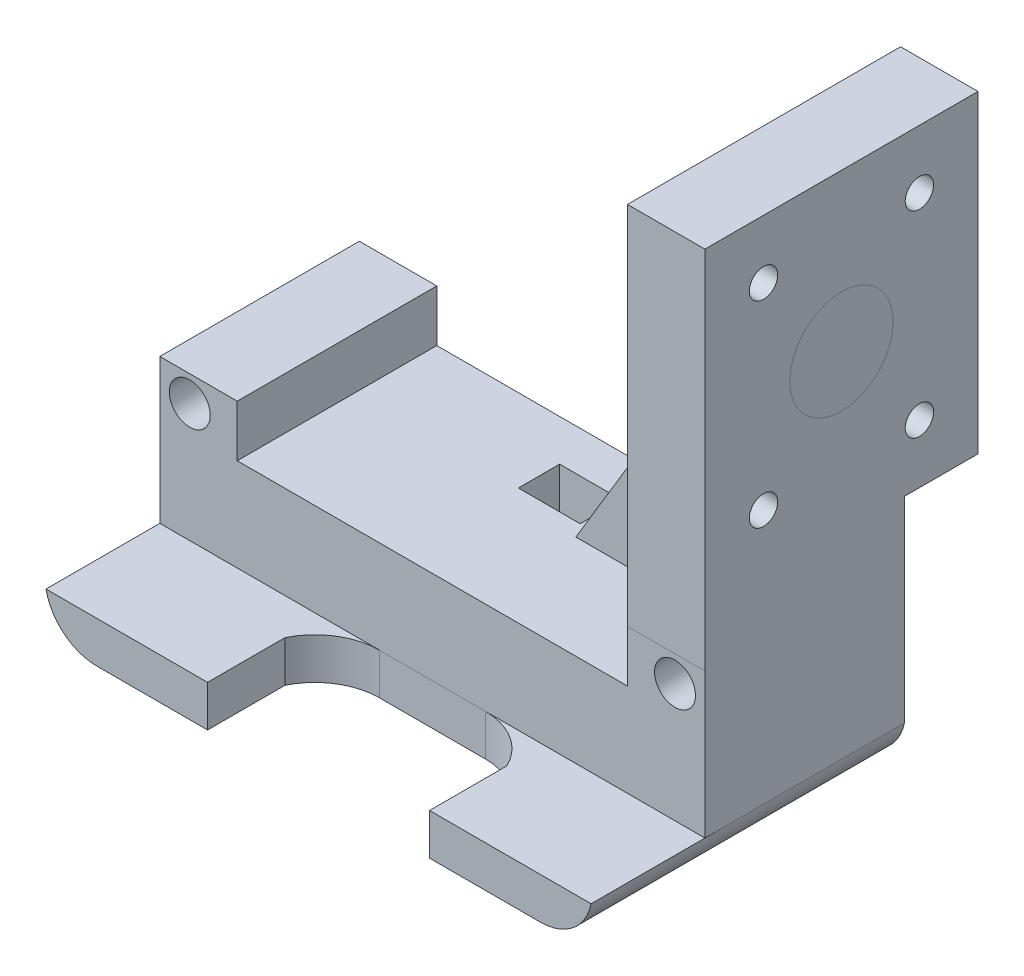
from build123d import *

# Parameters (mm, degrees)
SKETCH2_W                      = 90
SKETCH2_H                      = 30
BOSS_EXTRUDE1_DEPTH            = 184.15
SHELL1_T                       = 8
FILLET1_R                      = 10
CUT_EXTRUDE1_DEPTH             = 15
BOSS_EXTRUDE3_DEPTH            = 12.7
SKETCH19_W                     = 50.7
SKETCH19_H                     = 190.15
CUT_EXTRUDE3_DEPTH             = 160
CUT_EXTRUDE4_DEPTH             = 62.424750712
CUT_EXTRUDE5_DEPTH             = 83.99843372
CUT_EXTRUDE5_DEPTH_BACK        = 83.99843372
SKETCH21_W                     = 50.7
SKETCH21_H                     = 2
SKETCH22_W                     = 105.595917942
SKETCH22_H                     = 28.653888285
BOSS_EXTRUDE4_DEPTH            = 18
SKETCH25_W                     = 12
SKETCH25_H                     = 6
CUT_EXTRUDE7_DEPTH             = 69.833963067
BOSS_EXTRUDE6_DEPTH            = 10
SKETCH27_W                     = 12
SKETCH27_H                     = 8
BOSS_EXTRUDE7_DEPTH            = 26
SKETCH31_W                     = 15
SKETCH31_H                     = 38.653888285
BOSS_EXTRUDE8_DEPTH            = 10
F_5_16_0_3125_DIAMETER_HOLE2_D = 7.9375
SKETCH35_W                     = 52.9
SKETCH35_H                     = 70.8
BOSS_EXTRUDE9_DEPTH            = 15
F_5_5_5_5_DIAMETER_HOLE1_D     = 5.5
BOSS_EXTRUDE10_DEPTH           = 38.653888285
CUT_EXTRUDE8_DEPTH             = 20
CUT_EXTRUDE10_DEPTH            = 2
SKETCH43_W                     = 14.246111715
SKETCH43_H                     = 10
CUT_EXTRUDE11_DEPTH            = 157.542244125


with BuildPart() as part:
    # Sketch2 → Boss-Extrude1 (new body)
    with BuildSketch(Plane(origin=(0, 0, 0), x_dir=(1, 0, 0), z_dir=(0, 1, 0))):
        Rectangle(SKETCH2_W, SKETCH2_H)
    extrude(amount=BOSS_EXTRUDE1_DEPTH)

    # Shell1
    shell1_openings = [part.faces().sort_by_distance(p)[0] for p in [
        (0, 92.075, 15),
    ]]
    offset(amount=SHELL1_T, openings=shell1_openings, kind=Kind.INTERSECTION)

    # Fillet1
    # the kernel refuses this fillet: 10 mm, written as the material it adds along each edge
    with BuildSketch(Plane(origin=(-45, 0, -15), x_dir=(0, 1, 0), z_dir=(0, 0, 1)), Plane(origin=(45, 0, 15), x_dir=(0, 1, 0), z_dir=(0, 0, -1))) as fillet1_piece_1:
        with BuildLine():
            CenterArc((FILLET1_R, -FILLET1_R), FILLET1_R, 90, 90)
            Line((0, -FILLET1_R), (0, 0))
            Line((0, 0), (FILLET1_R, 0))
        make_face()
    extrude(amount=30)
    with BuildSketch(Plane(origin=(-45, 184.15, -15), x_dir=(0, -1, 0), z_dir=(0, 0, 1)), Plane(origin=(45, 184.15, 15), x_dir=(0, -1, 0), z_dir=(0, 0, -1))) as fillet1_piece_2:
        with BuildLine():
            CenterArc((FILLET1_R, FILLET1_R), FILLET1_R, 180, 90)
            Line((0, FILLET1_R), (0, 0))
            Line((0, 0), (FILLET1_R, 0))
        make_face()
    extrude(amount=30)
    # the kernel refuses this fillet: 10 mm, written as the material it takes off along each edge
    with BuildSketch(Plane(origin=(53, 192.15, 40), x_dir=(0, -1, 0), z_dir=(0, 0, -1)), Plane(origin=(-53, 192.15, -48), x_dir=(0, -1, 0), z_dir=(0, 0, 1)), Plane(origin=(-53, -8, -48), x_dir=(1, 0, 0), z_dir=(0, 0, 1))) as fillet1_2_piece_1:
        with BuildLine():
            CenterArc((FILLET1_R, FILLET1_R), FILLET1_R, 180, 90)
            Line((0, FILLET1_R), (0, 0))
            Line((0, 0), (FILLET1_R, 0))
        make_face()
    extrude(amount=88, mode=Mode.SUBTRACT)
    with BuildSketch(Plane(origin=(53, -8, 40), x_dir=(0, 1, 0), z_dir=(0, 0, -1))) as fillet1_2_piece_2:
        with BuildLine():
            CenterArc((FILLET1_R, -FILLET1_R), FILLET1_R, 90, 90)
            Line((0, -FILLET1_R), (0, 0))
            Line((0, 0), (FILLET1_R, 0))
        make_face()
    extrude(amount=88, mode=Mode.SUBTRACT)

    # Sketch3 → Cut-Extrude1 (cut)
    with BuildSketch(Plane.XZ.offset(8)):
        with BuildLine():
            Line((-21.5, 15), (21.5, 15))
            Line((21.5, 15), (21.5, 0))
            ThreePointArc((21.5, 0), (16.888679541, -5.139118926), (10.252551286, -7.046111715))
            Line((10.252551286, -7.046111715), (-10.252551286, -7.046111715))
            ThreePointArc((-10.252551286, -7.046111715), (-16.888679541, -5.139118926), (-21.5, 0))
            Line((-21.5, 0), (-21.5, 15))
        make_face()
    extrude(amount=-CUT_EXTRUDE1_DEPTH, mode=Mode.SUBTRACT)

    # Sketch16 → Boss-Extrude3 (add)
    with BuildSketch(Plane(origin=(0, 0, -23), x_dir=(-1, 0, 0), z_dir=(0, 0, -1))):
        with BuildLine():
            Line((-53, 182.15), (-53, 2))
            ThreePointArc((-53, 2), (-50.071067812, -5.071067812), (-43, -8))
            Line((-43, -8), (43, -8))
            ThreePointArc((43, -8), (50.071067812, -5.071067812), (53, 2))
            Line((53, 2), (53, 182.15))
            ThreePointArc((53, 182.15), (50.071067812, 189.221067812), (43, 192.15))
            Line((43, 192.15), (-43, 192.15))
            ThreePointArc((-43, 192.15), (-50.071067812, 189.221067812), (-53, 182.15))
        make_face()
    extrude(amount=BOSS_EXTRUDE3_DEPTH)

    # Sketch19 → Cut-Extrude3 (cut)
    with BuildSketch(Plane(origin=(53, 0, 0), x_dir=(0, 0, -1), z_dir=(1, 0, 0))):
        with Locations((10.35, 97.075)):
            Rectangle(SKETCH19_W, SKETCH19_H)
    extrude(amount=-CUT_EXTRUDE3_DEPTH, mode=Mode.SUBTRACT)

    # Sketch20 → Cut-Extrude4 (cut, through all)
    with BuildSketch(Plane.XY.offset(-15)):
        with BuildLine():
            Line((41, 2), (-41, 2))
            ThreePointArc((-41, 2), (-38.16227766, 0.513167019), (-35, 0))
            Line((-35, 0), (35, 0))
            ThreePointArc((35, 0), (38.16227766, 0.513167019), (41, 2))
        make_face()
    extrude(amount=-CUT_EXTRUDE4_DEPTH, mode=Mode.SUBTRACT)

    # Sketch21 → Cut-Extrude5 (cut, two sides: drawn at the far end of the back side and taken through both)
    with BuildSketch(Plane.ZY.offset(-21.5).offset(-CUT_EXTRUDE5_DEPTH_BACK)):
        with Locations((-10.35, 1)):
            Rectangle(SKETCH21_W, SKETCH21_H)
    extrude(amount=CUT_EXTRUDE5_DEPTH + CUT_EXTRUDE5_DEPTH_BACK, mode=Mode.SUBTRACT)

    # Sketch22 → Boss-Extrude4 (add)
    with BuildSketch(Plane(origin=(0, 0, 0), x_dir=(1, 0, 0), z_dir=(0, 1, 0))):
        with Locations((0, 21.373055858)):
            Rectangle(SKETCH22_W, SKETCH22_H)
    extrude(amount=BOSS_EXTRUDE4_DEPTH)

    # Sketch25 → Cut-Extrude7 (cut, through all)
    with BuildSketch(Plane(origin=(0, 18, 0), x_dir=(1, 0, 0), z_dir=(0, 1, 0))):
        with Locations((0, 32.7)):
            Rectangle(SKETCH25_W, SKETCH25_H)
    extrude(amount=-CUT_EXTRUDE7_DEPTH, mode=Mode.SUBTRACT)

    # Sketch26 → Boss-Extrude6 (add)
    with BuildSketch(Plane(origin=(0, 0, -35.7), x_dir=(-1, 0, 0), z_dir=(0, 0, -1))):
        with BuildLine():
            Line((6, 18), (6, -8))
            Line((6, -8), (43, -8))
            ThreePointArc((43, -8), (49.32455532, -5.745966692), (52.797958971, 0))
            Line((52.797958971, 0), (52.797958971, 18))
            Line((52.797958971, 18), (6, 18))
        make_face()
        with BuildLine():
            Line((-6, -8), (-6, 18))
            Line((-6, 18), (-52.797958971, 18))
            Line((-52.797958971, 18), (-52.797958971, 0))
            ThreePointArc((-52.797958971, 0), (-49.32455532, -5.745966692), (-43, -8))
            Line((-43, -8), (-6, -8))
        make_face()
    extrude(amount=BOSS_EXTRUDE6_DEPTH)

    # Sketch27 → Boss-Extrude7 (add)
    with BuildSketch(Plane.XZ.offset(8)):
        with Locations((0, -41.7)):
            Rectangle(SKETCH27_W, SKETCH27_H)
    extrude(amount=-BOSS_EXTRUDE7_DEPTH)

    # Sketch31 → Boss-Extrude8 (add)
    with BuildSketch(Plane(origin=(0, 18, 0), x_dir=(1, 0, 0), z_dir=(0, 1, 0))):
        with Locations((-45.297958971, 26.373055858)):
            Rectangle(SKETCH31_W, SKETCH31_H)
        with Locations((45.297958971, 26.373055858)):
            Rectangle(SKETCH31_W, SKETCH31_H)
    extrude(amount=BOSS_EXTRUDE8_DEPTH)

    # 5/16 (0.3125) Diameter Hole2 (through all)
    with Locations(Plane.XY.offset(-7.046111715)):
        with Locations((-47, 23), (47, 23)):
            Hole(F_5_16_0_3125_DIAMETER_HOLE2_D / 2)

    # Sketch35 → Boss-Extrude9 (add)
    with BuildSketch(Plane(origin=(52.797958971, 0, 0), x_dir=(0, 0, -1), z_dir=(1, 0, 0))):
        with Locations((33.496111715, 63.4)):
            Rectangle(SKETCH35_W, SKETCH35_H)
    extrude(amount=-BOSS_EXTRUDE9_DEPTH)

    # Ø5.5 (5.5) Diameter Hole1 (through all)
    with Locations(Plane(origin=(52.797958971, 0, 0), x_dir=(0, 0, -1), z_dir=(1, 0, 0))):
        with Locations((48.596111715, 87.45), (18.396111715, 87.45), (18.396111715, 49.35), (48.596111715, 49.35)):
            Hole(F_5_5_5_5_DIAMETER_HOLE1_D / 2)

    # Sketch39 → Boss-Extrude10 (add)
    with BuildSketch(Plane.XY.offset(-7.046111715)):
        Polygon((7.797958971, 18), (37.797958971, 18), (37.797958971, 68), align=None)
    extrude(amount=-BOSS_EXTRUDE10_DEPTH)

    # Sketch40 → Cut-Extrude8 (cut)
    with BuildSketch(Plane.XY.offset(-7.046111715)):
        Polygon((37.797958971, 68), (7.797958971, 18), (37.797958971, 18), align=None)
    extrude(amount=-CUT_EXTRUDE8_DEPTH, mode=Mode.SUBTRACT)

    # Sketch42 → Cut-Extrude10 (cut)
    with BuildSketch(Plane(origin=(0, 0, -45.7), x_dir=(-1, 0, 0), z_dir=(0, 0, -1))):
        Polygon((-37.797958971, 68), (-7.797958971, 18), (-37.797958971, 18), align=None)
    extrude(amount=-CUT_EXTRUDE10_DEPTH, mode=Mode.SUBTRACT)

    # Sketch43 → Cut-Extrude11 (cut, through all)
    with BuildSketch(Plane(origin=(52.797958971, 0, 0), x_dir=(0, 0, -1), z_dir=(1, 0, 0))):
        with Locations((52.823055858, 33)):
            Rectangle(SKETCH43_W, SKETCH43_H)
    extrude(amount=-CUT_EXTRUDE11_DEPTH, mode=Mode.SUBTRACT)


solid = part.part
